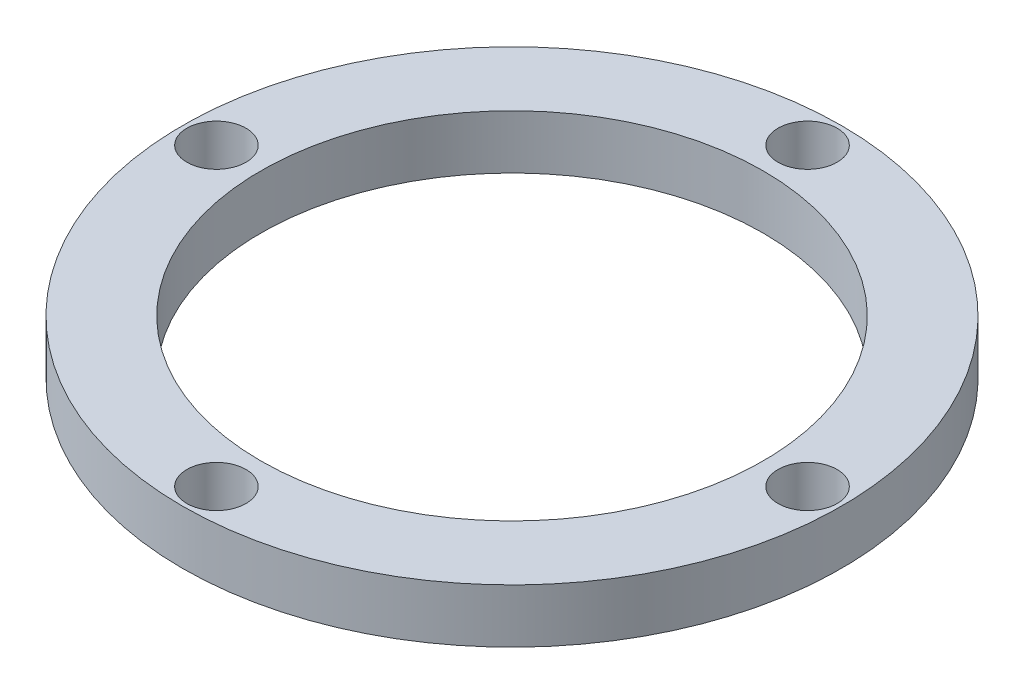
from build123d import *

# Parameters (mm, degrees)
SKETCH1_R           = 22.300536673
SKETCH1_R_2         = 17
BOSS_EXTRUDE1_DEPTH = 3.65
SKETCH2_R           = 2
CUT_EXTRUDE1_DEPTH  = 32.748234152


with BuildPart() as part:
    # Sketch1 → Boss-Extrude1 (new body)
    with BuildSketch(Plane(origin=(0, 0, 0), x_dir=(1, 0, 0), z_dir=(0, 1, 0))):
        Circle(SKETCH1_R)
        Circle(SKETCH1_R_2, mode=Mode.SUBTRACT)
    extrude(amount=BOSS_EXTRUDE1_DEPTH)

    # Sketch2 → Cut-Extrude1 (cut, through all)
    with BuildSketch(Plane(origin=(0, 3.65, 0), x_dir=(1, 0, 0), z_dir=(0, 1, 0))):
        with Locations((0, 20)):
            Circle(SKETCH2_R)
        with Locations((20, 0)):
            Circle(SKETCH2_R)
        with Locations((0, -20)):
            Circle(SKETCH2_R)
        with Locations((-20, 0)):
            Circle(SKETCH2_R)
    extrude(amount=-CUT_EXTRUDE1_DEPTH, mode=Mode.SUBTRACT)


solid = part.part
